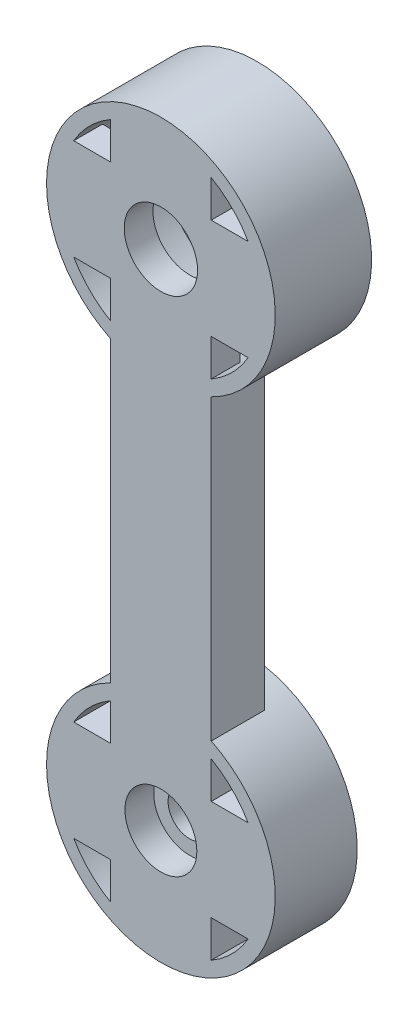
from build123d import *
from build123d.topology import SkipClean

# Parameters (mm, degrees)
SKETCH1_R           = 1.5
BOSS_EXTRUDE4_DEPTH = 3
BOSS_EXTRUDE5_START = 3
SKETCH3_R           = 7.95
SKETCH3_R_2         = 1.5
BOSS_EXTRUDE5_DEPTH = 3
SKETCH4_R           = 2.5
CUT_EXTRUDE1_DEPTH  = 1.5
SKETCH5_R           = 7
CUT_EXTRUDE2_DEPTH  = 4
SKETCH6_R           = 7.95
CUT_EXTRUDE3_DEPTH  = 1
SKETCH7_R           = 2.5
CUT_EXTRUDE4_DEPTH  = 0.5
BOSS_EXTRUDE6_START = 0.7
SKETCH8_R           = 7.95
SKETCH8_R_2         = 7
BOSS_EXTRUDE6_DEPTH = 0.7
BOSS_EXTRUDE8_START = 0.7
SKETCH9_R           = 7.95
SKETCH9_R_2         = 1.5
BOSS_EXTRUDE8_DEPTH = 0.7
BOSS_EXTRUDE9_START = 0.7
BOSS_EXTRUDE9_DEPTH = 0.7
SKETCH11_R          = 2.55
CUT_EXTRUDE5_DEPTH  = 45.190440143


with BuildPart() as part:
    # Sketch1 → Boss-Extrude4 (new body)
    with BuildSketch(Plane.XY):
        with BuildLine():
            Line((-3.5, -7.138101989), (-3.5, -27.861898011))
            ThreePointArc((-3.5, -27.861898011), (0, -42.95), (3.5, -27.861898011))
            Line((3.5, -27.861898011), (3.5, -7.138101989))
            ThreePointArc((3.5, -7.138101989), (0, 7.95), (-3.5, -7.138101989))
        make_face()
        with BuildLine():
            Line((-3.5, 6.062177826), (-3.5, 3.5))
            Line((-3.5, 3.5), (-6.062177826, 3.5))
            ThreePointArc((-6.062177826, 3.5), (-4.949747468, 4.949747468), (-3.5, 6.062177826))
        make_face(mode=Mode.SUBTRACT)
        with BuildLine():
            Line((3.5, 3.5), (3.5, 6.062177826))
            ThreePointArc((3.5, 6.062177826), (4.949747468, 4.949747468), (6.062177826, 3.5))
            Line((6.062177826, 3.5), (3.5, 3.5))
        make_face(mode=Mode.SUBTRACT)
        Circle(SKETCH1_R, mode=Mode.SUBTRACT)
        with BuildLine():
            Line((-6.062177826, -3.5), (-3.5, -3.5))
            Line((-3.5, -3.5), (-3.5, -6.062177826))
            ThreePointArc((-3.5, -6.062177826), (-4.949747468, -4.949747468), (-6.062177826, -3.5))
        make_face(mode=Mode.SUBTRACT)
        with BuildLine():
            Line((3.5, -3.5), (6.062177826, -3.5))
            ThreePointArc((6.062177826, -3.5), (4.949747468, -4.949747468), (3.5, -6.062177826))
            Line((3.5, -6.062177826), (3.5, -3.5))
        make_face(mode=Mode.SUBTRACT)
        with BuildLine():
            ThreePointArc((3.5, -28.937822174), (4.949747468, -30.050252532), (6.062177826, -31.5))
            Line((6.062177826, -31.5), (3.5, -31.5))
            Line((3.5, -31.5), (3.5, -28.937822174))
        make_face(mode=Mode.SUBTRACT)
        with BuildLine():
            Line((-3.5, -28.937822174), (-3.5, -31.5))
            Line((-3.5, -31.5), (-6.062177826, -31.5))
            ThreePointArc((-6.062177826, -31.5), (-4.949747468, -30.050252532), (-3.5, -28.937822174))
        make_face(mode=Mode.SUBTRACT)
        with BuildLine():
            ThreePointArc((-3.5, -41.062177826), (-4.949747468, -39.949747468), (-6.062177826, -38.5))
            Line((-6.062177826, -38.5), (-3.5, -38.5))
            Line((-3.5, -38.5), (-3.5, -41.062177826))
        make_face(mode=Mode.SUBTRACT)
        with BuildLine():
            ThreePointArc((6.062177826, -38.5), (4.949747468, -39.949747468), (3.5, -41.062177826))
            Line((3.5, -41.062177826), (3.5, -38.5))
            Line((3.5, -38.5), (6.062177826, -38.5))
        make_face(mode=Mode.SUBTRACT)
        with Locations((0, -35)):
            Circle(SKETCH1_R, mode=Mode.SUBTRACT)
    extrude(amount=BOSS_EXTRUDE4_DEPTH)

    # Sketch3 → Boss-Extrude5 (add)
    # profile 1 of 2: a face of its own
    with SkipClean():  # the faces are left unmerged after this step: merging them gives an invalid solid
        with BuildSketch(Plane(origin=(0, 0, 0), x_dir=(-1, 0, 0), z_dir=(0, 0, -1)).offset(BOSS_EXTRUDE5_START)):
            Circle(SKETCH3_R)
            with BuildLine():
                Line((3.5, 3.5), (3.5, 6.062177826))
                ThreePointArc((3.5, 6.062177826), (4.949747468, 4.949747468), (6.062177826, 3.5))
                Line((6.062177826, 3.5), (3.5, 3.5))
            make_face(mode=Mode.SUBTRACT)
            with BuildLine():
                Line((3.5, -3.5), (6.062177826, -3.5))
                ThreePointArc((6.062177826, -3.5), (4.949747468, -4.949747468), (3.5, -6.062177826))
                Line((3.5, -6.062177826), (3.5, -3.5))
            make_face(mode=Mode.SUBTRACT)
            with BuildLine():
                Line((-3.5, -3.5), (-3.5, -6.062177826))
                ThreePointArc((-3.5, -6.062177826), (-4.949747468, -4.949747468), (-6.062177826, -3.5))
                Line((-6.062177826, -3.5), (-3.5, -3.5))
            make_face(mode=Mode.SUBTRACT)
            with BuildLine():
                Line((-3.5, 3.5), (-6.062177826, 3.5))
                ThreePointArc((-6.062177826, 3.5), (-4.949747468, 4.949747468), (-3.5, 6.062177826))
                Line((-3.5, 6.062177826), (-3.5, 3.5))
            make_face(mode=Mode.SUBTRACT)
            Circle(SKETCH3_R_2, mode=Mode.SUBTRACT)
        # profile 2 of 2: a face of its own
        with BuildSketch(Plane(origin=(0, 0, 0), x_dir=(-1, 0, 0), z_dir=(0, 0, -1)).offset(BOSS_EXTRUDE5_START)):
            with Locations((0, -35)):
                Circle(SKETCH3_R)
            with BuildLine():
                Line((-3.5, -38.5), (-3.5, -41.062177826))
                ThreePointArc((-3.5, -41.062177826), (-4.949747468, -39.949747468), (-6.062177826, -38.5))
                Line((-6.062177826, -38.5), (-3.5, -38.5))
            make_face(mode=Mode.SUBTRACT)
            with BuildLine():
                Line((-3.5, -31.5), (-6.062177826, -31.5))
                ThreePointArc((-6.062177826, -31.5), (-4.949747468, -30.050252532), (-3.5, -28.937822174))
                Line((-3.5, -28.937822174), (-3.5, -31.5))
            make_face(mode=Mode.SUBTRACT)
            with BuildLine():
                Line((3.5, -31.5), (3.5, -28.937822174))
                ThreePointArc((3.5, -28.937822174), (4.949747468, -30.050252532), (6.062177826, -31.5))
                Line((6.062177826, -31.5), (3.5, -31.5))
            make_face(mode=Mode.SUBTRACT)
            with BuildLine():
                Line((3.5, -38.5), (6.062177826, -38.5))
                ThreePointArc((6.062177826, -38.5), (4.949747468, -39.949747468), (3.5, -41.062177826))
                Line((3.5, -41.062177826), (3.5, -38.5))
            make_face(mode=Mode.SUBTRACT)
            with Locations((0, -35)):
                Circle(SKETCH3_R_2, mode=Mode.SUBTRACT)
        extrude(amount=-BOSS_EXTRUDE5_DEPTH)

    # Sketch4 → Cut-Extrude1 (cut)
    with SkipClean():  # the faces are left unmerged after this step: merging them gives an invalid solid
        with BuildSketch(Plane.XY.offset(3)):
            with Locations((0, -35)):
                Circle(SKETCH4_R)
            Circle(SKETCH4_R)
        extrude(amount=-CUT_EXTRUDE1_DEPTH, mode=Mode.SUBTRACT)

    # Sketch5 → Cut-Extrude2 (cut)
    with SkipClean():  # the faces are left unmerged after this step: merging them gives an invalid solid
        with BuildSketch(Plane(origin=(0, 0, -3), x_dir=(-1, 0, 0), z_dir=(0, 0, -1))):
            Circle(SKETCH5_R)
        extrude(amount=-CUT_EXTRUDE2_DEPTH, mode=Mode.SUBTRACT)
    add(part.part.scale(1), mode=Mode.REPLACE)  # the faces are merged on a copy

    # Sketch6 → Cut-Extrude3 (cut)
    with BuildSketch(Plane(origin=(0, 0, -3), x_dir=(-1, 0, 0), z_dir=(0, 0, -1))):
        with Locations((0, -35)):
            Circle(SKETCH6_R)
    extrude(amount=-CUT_EXTRUDE3_DEPTH, mode=Mode.SUBTRACT)

    # Sketch7 → Cut-Extrude4 (cut)
    with BuildSketch(Plane.XY.offset(1.5)):
        with Locations((0, -35)):
            Circle(SKETCH7_R)
    extrude(amount=-CUT_EXTRUDE4_DEPTH, mode=Mode.SUBTRACT)

    # Sketch8 → Boss-Extrude6 (add)
    with BuildSketch(Plane(origin=(0, 0, -3), x_dir=(-1, 0, 0), z_dir=(0, 0, -1)).offset(BOSS_EXTRUDE6_START)):
        Circle(SKETCH8_R)
        Circle(SKETCH8_R_2, mode=Mode.SUBTRACT)
    extrude(amount=-BOSS_EXTRUDE6_DEPTH)

    # Sketch9 → Boss-Extrude8 (add)
    with SkipClean():  # the faces are left unmerged after this step: merging them gives an invalid solid
        with BuildSketch(Plane(origin=(0, 0, -2), x_dir=(-1, 0, 0), z_dir=(0, 0, -1)).offset(BOSS_EXTRUDE8_START)):
            with Locations((0, -35)):
                Circle(SKETCH9_R)
            with BuildLine():
                Line((3.5, -31.5), (3.5, -28.937822174))
                ThreePointArc((3.5, -28.937822174), (4.949747468, -30.050252532), (6.062177826, -31.5))
                Line((6.062177826, -31.5), (3.5, -31.5))
            make_face(mode=Mode.SUBTRACT)
            with BuildLine():
                Line((3.5, -38.5), (6.062177826, -38.5))
                ThreePointArc((6.062177826, -38.5), (4.949747468, -39.949747468), (3.5, -41.062177826))
                Line((3.5, -41.062177826), (3.5, -38.5))
            make_face(mode=Mode.SUBTRACT)
            with BuildLine():
                Line((-3.5, -38.5), (-3.5, -41.062177826))
                ThreePointArc((-3.5, -41.062177826), (-4.949747468, -39.949747468), (-6.062177826, -38.5))
                Line((-6.062177826, -38.5), (-3.5, -38.5))
            make_face(mode=Mode.SUBTRACT)
            with BuildLine():
                Line((-3.5, -31.5), (-6.062177826, -31.5))
                ThreePointArc((-6.062177826, -31.5), (-4.949747468, -30.050252532), (-3.5, -28.937822174))
                Line((-3.5, -28.937822174), (-3.5, -31.5))
            make_face(mode=Mode.SUBTRACT)
            with Locations((0, -35)):
                Circle(SKETCH9_R_2, mode=Mode.SUBTRACT)
        extrude(amount=-BOSS_EXTRUDE8_DEPTH)

    # Sketch10 → Boss-Extrude9 (add)
    with SkipClean():  # the faces are left unmerged after this step: merging them gives an invalid solid
        with BuildSketch(Plane(origin=(0, 0, 0), x_dir=(-1, 0, 0), z_dir=(0, 0, -1)).offset(BOSS_EXTRUDE9_START)):
            with BuildLine():
                ThreePointArc((3.5, -7.138101989), (0, -7.95), (-3.5, -7.138101989))
                Line((-3.5, -7.138101989), (-3.5, -27.861898011))
                ThreePointArc((-3.5, -27.861898011), (0, -27.05), (3.5, -27.861898011))
                Line((3.5, -27.861898011), (3.5, -7.138101989))
            make_face()
        extrude(amount=-BOSS_EXTRUDE9_DEPTH)

    # Sketch11 → Cut-Extrude5 (cut, through all)
    with SkipClean():  # the faces are left unmerged after this step: merging them gives an invalid solid
        with BuildSketch(Plane.XY.offset(3)):
            Circle(SKETCH11_R)
        extrude(amount=-CUT_EXTRUDE5_DEPTH, mode=Mode.SUBTRACT)


solid = part.part
